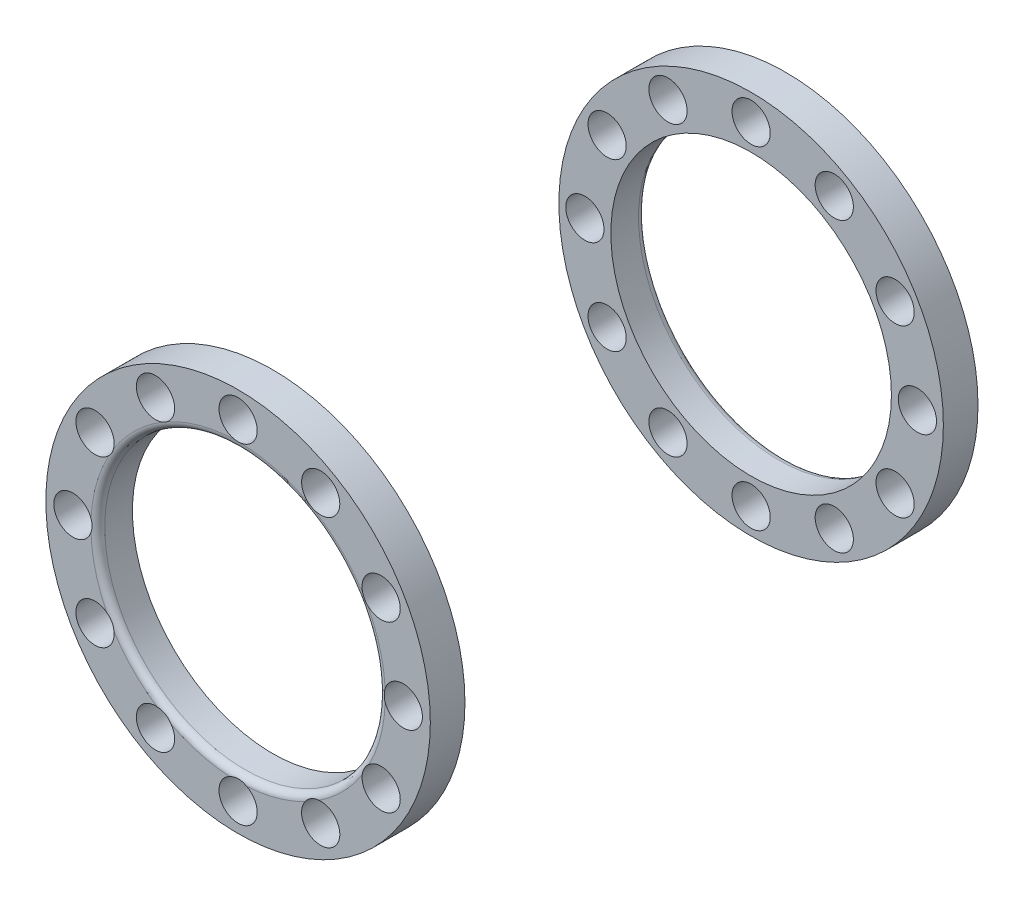
from build123d import *

# Parameters (mm, degrees)
SKETCH5_R           = 55.506115836
SKETCH5_R_2         = 40.506115836
SKETCH5_R_3         = 5.518684336
BOSS_EXTRUDE1_DEPTH = 10
SKETCH1_R           = 55.506115836
SKETCH1_R_2         = 40.506115836
SKETCH1_R_3         = 5.518684336
BOSS_EXTRUDE2_DEPTH = 10
FILLET1_R           = 2
FILLET4_R           = 2


with BuildPart() as part:
    # Sketch5 → Boss-Extrude1 (new body)
    with BuildSketch(Plane.XY.offset(138.12990696)):
        with Locations((0, -0.310226717)):
            Circle(SKETCH5_R)
        with Locations((0, -0.310226717)):
            Circle(SKETCH5_R_2, mode=Mode.SUBTRACT)
        with Locations((0, 47.695889119)):
            Circle(SKETCH5_R_3, mode=Mode.SUBTRACT)
        with Locations((23.84794456, 41.305851633)):
            Circle(SKETCH5_R_3, mode=Mode.SUBTRACT)
        with Locations((41.305851633, 23.84794456)):
            Circle(SKETCH5_R_3, mode=Mode.SUBTRACT)
        with Locations((47.695889119, 0)):
            Circle(SKETCH5_R_3, mode=Mode.SUBTRACT)
        with Locations((41.305851633, -23.84794456)):
            Circle(SKETCH5_R_3, mode=Mode.SUBTRACT)
        with Locations((23.84794456, -41.305851633)):
            Circle(SKETCH5_R_3, mode=Mode.SUBTRACT)
        with Locations((0, -47.695889119)):
            Circle(SKETCH5_R_3, mode=Mode.SUBTRACT)
        with Locations((-23.84794456, -41.305851633)):
            Circle(SKETCH5_R_3, mode=Mode.SUBTRACT)
        with Locations((-41.305851633, -23.84794456)):
            Circle(SKETCH5_R_3, mode=Mode.SUBTRACT)
        with Locations((-47.695889119, 0)):
            Circle(SKETCH5_R_3, mode=Mode.SUBTRACT)
        with Locations((-41.305851633, 23.84794456)):
            Circle(SKETCH5_R_3, mode=Mode.SUBTRACT)
        with Locations((-23.84794456, 41.305851633)):
            Circle(SKETCH5_R_3, mode=Mode.SUBTRACT)
    extrude(amount=BOSS_EXTRUDE1_DEPTH)

    # Fillet1
    # the kernel refuses this fillet: 2 mm, written as the material it takes off along each edge
    with BuildSketch(Plane(origin=(0, -0.310226717, 148.12990696), x_dir=(1, 0, 0), z_dir=(0, -1, 0))) as fillet1_piece_1:
        with BuildLine():
            CenterArc((40.506115836 + FILLET1_R, -FILLET1_R), FILLET1_R, 90, 90)
            Line((40.506115836 + FILLET1_R, 0), (40.506115836, 0))
            Line((40.506115836, 0), (40.506115836, -FILLET1_R))
        make_face()
    revolve(axis=Axis((0, -0.310226717, 148.12990696), (0, 0, 1)), mode=Mode.SUBTRACT)


with BuildPart() as body_2:
    # Sketch1 → Boss-Extrude2 (new body)
    with BuildSketch(Plane.XY):
        Circle(SKETCH1_R)
        Circle(SKETCH1_R_2, mode=Mode.SUBTRACT)
        with Locations((0, 48.006115836)):
            Circle(SKETCH1_R_3, mode=Mode.SUBTRACT)
        with Locations((24.003057918, 41.574515851)):
            Circle(SKETCH1_R_3, mode=Mode.SUBTRACT)
        with Locations((41.574515851, 24.003057918)):
            Circle(SKETCH1_R_3, mode=Mode.SUBTRACT)
        with Locations((48.006115836, 0)):
            Circle(SKETCH1_R_3, mode=Mode.SUBTRACT)
        with Locations((41.574515851, -24.003057918)):
            Circle(SKETCH1_R_3, mode=Mode.SUBTRACT)
        with Locations((24.003057918, -41.574515851)):
            Circle(SKETCH1_R_3, mode=Mode.SUBTRACT)
        with Locations((0, -48.006115836)):
            Circle(SKETCH1_R_3, mode=Mode.SUBTRACT)
        with Locations((-24.003057918, -41.574515851)):
            Circle(SKETCH1_R_3, mode=Mode.SUBTRACT)
        with Locations((-41.574515851, -24.003057918)):
            Circle(SKETCH1_R_3, mode=Mode.SUBTRACT)
        with Locations((-48.006115836, 0)):
            Circle(SKETCH1_R_3, mode=Mode.SUBTRACT)
        with Locations((-41.574515851, 24.003057918)):
            Circle(SKETCH1_R_3, mode=Mode.SUBTRACT)
        with Locations((-24.003057918, 41.574515851)):
            Circle(SKETCH1_R_3, mode=Mode.SUBTRACT)
    extrude(amount=-BOSS_EXTRUDE2_DEPTH)

    # Fillet4
    fillet4_edges = [body_2.edges().sort_by_distance(p)[0] for p in [
        (-40.506115836, 0, -10),
    ]]
    fillet(fillet4_edges, radius=FILLET4_R)


solid = Compound([part.part, body_2.part])
